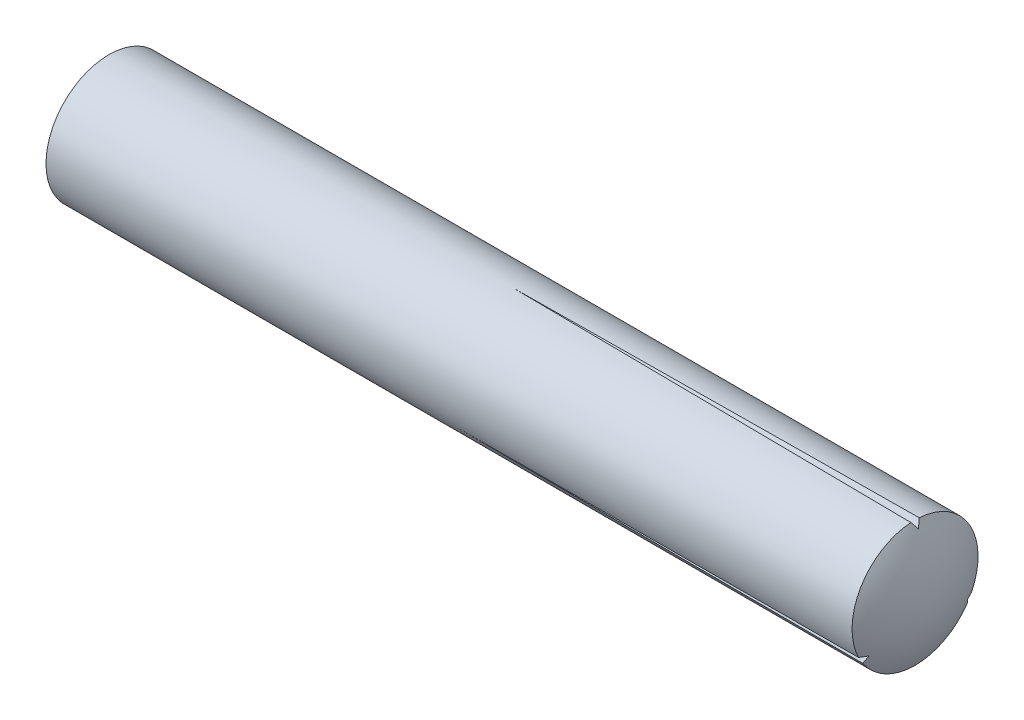
from build123d import *

# Parameters (mm, degrees)
CIRPATTERN2_COUNT = 3


with BuildPart() as part:
    # Sketch1 → Base-Revolve (revolve)
    with BuildSketch(Plane.XY):
        with BuildLine():
            Line((10, 0), (0, 0))
            ThreePointArc((0, 0), (0.051111261, 0.388228568), (0.200961894, 0.75))
            Line((0.200961894, 0.75), (9.799038106, 0.75))
            ThreePointArc((9.799038106, 0.75), (9.948888739, 0.388228568), (10, 0))
        make_face()
    revolve(axis=Axis((-11.749551864, 0, 0), (1, 0, 0)))

    # Sketch4 → Cut-Loft2 section 0
    with BuildSketch(Plane(origin=(10, 0, 0), x_dir=(0, 0, -1), z_dir=(1, 0, 0)), mode=Mode.PRIVATE) as cut_loft2_s0:
        with BuildLine():
            Line((-0.052515565, 0.75), (0, 0.675))
            Line((0, 0.675), (0.052515565, 0.75))
            Line((0.052515565, 0.75), (-0.052515565, 0.75))
        make_face()
    cut_loft2 = loft([Vertex(5, 0.75, 0), cut_loft2_s0.sketch], mode=Mode.SUBTRACT)

    # CirPattern2: Cut-Loft2 ×3 about axis
    cirpattern2_axis = Axis((-11.749551864, 0, 0), (1, 0, 0))
    for i in range(1, CIRPATTERN2_COUNT):
        add(cut_loft2.rotate(cirpattern2_axis, i * 360 / CIRPATTERN2_COUNT), mode=Mode.SUBTRACT)


solid = part.part
